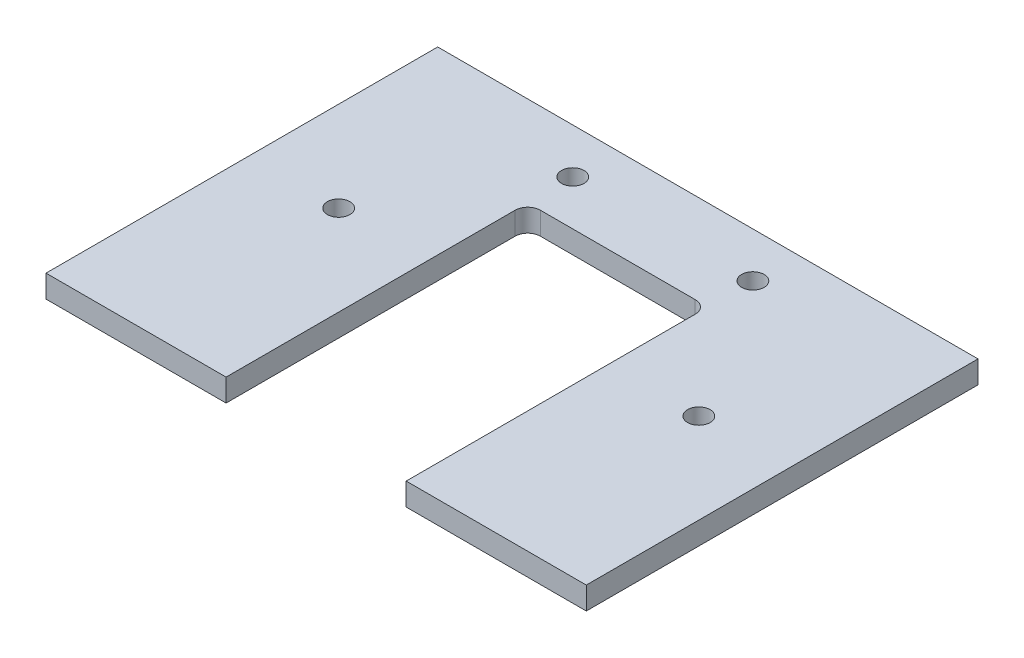
from build123d import *

# Parameters (mm, degrees)
SKETCH1_R           = 1.5875
BOSS_EXTRUDE1_DEPTH = 3.175
FILLET1_R           = 1.778


with BuildPart() as part:
    # Sketch1 → Boss-Extrude1 (new body)
    with BuildSketch(Plane(origin=(0, 0, 0), x_dir=(1, 0, 0), z_dir=(0, 1, 0))):
        Polygon((38.1, 12.7), (-38.1, 12.7), (-38.1, -42.545), (-12.7, -42.545), (-12.7, 0), (12.7, 0), (12.7, -42.545), (38.1, -42.545), align=None)
        with Locations((-25.4, -13.97)):
            Circle(SKETCH1_R, mode=Mode.SUBTRACT)
        with Locations((25.4, -13.97)):
            Circle(SKETCH1_R, mode=Mode.SUBTRACT)
        with Locations((-12.7, 6.35)):
            Circle(SKETCH1_R, mode=Mode.SUBTRACT)
        with Locations((12.7, 6.35)):
            Circle(SKETCH1_R, mode=Mode.SUBTRACT)
    extrude(amount=BOSS_EXTRUDE1_DEPTH)

    # Fillet1
    fillet1_edges = [part.edges().sort_by_distance(p)[0] for p in [
        (12.7, 1.5875, 0),
        (-12.7, 1.5875, 0),
    ]]
    fillet(fillet1_edges, radius=FILLET1_R)


solid = part.part
